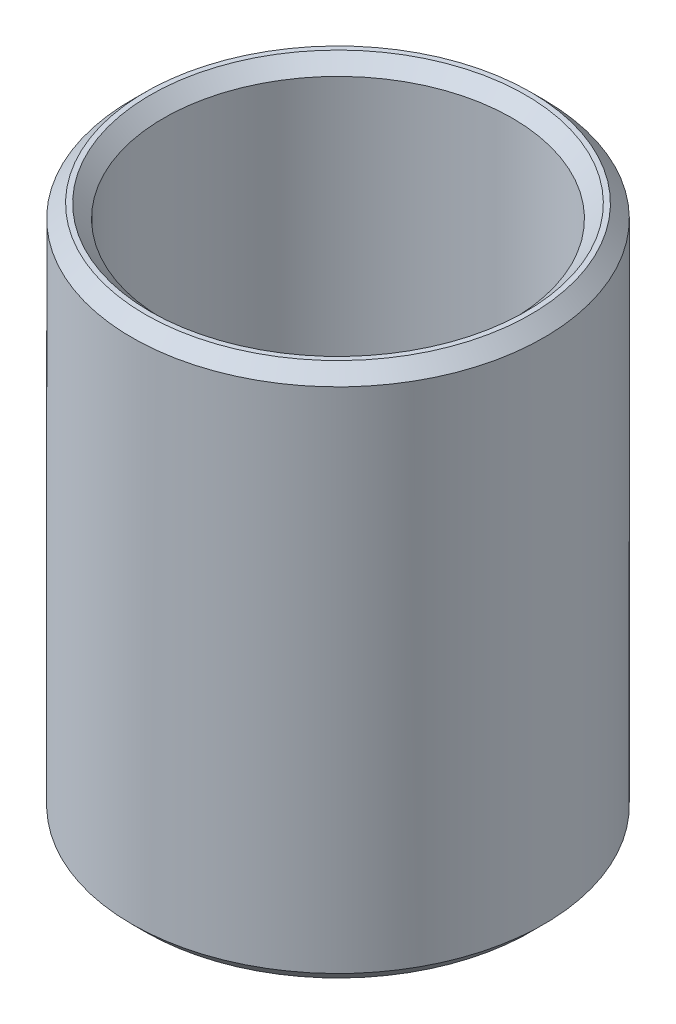
from build123d import *

# Parameters (mm, degrees)
SKETCH1_R           = 60
BOSS_EXTRUDE1_DEPTH = 155.73988297
SKETCH2_R           = 50.764711416
CUT_EXTRUDE1_DEPTH  = 178.355324553
CHAMFER1_SIZE       = 3.887636681


with BuildPart() as part:
    # Sketch1 → Boss-Extrude1 (new body)
    with BuildSketch(Plane(origin=(0, 0, 0), x_dir=(1, 0, 0), z_dir=(0, 1, 0))):
        Circle(SKETCH1_R)
    extrude(amount=BOSS_EXTRUDE1_DEPTH)

    # Sketch2 → Cut-Extrude1 (cut, through all)
    with BuildSketch(Plane(origin=(0, 0, 0), x_dir=(1, 0, 0), z_dir=(0, 1, 0))):
        Circle(SKETCH2_R)
    extrude(amount=CUT_EXTRUDE1_DEPTH, mode=Mode.SUBTRACT)

    # Chamfer1
    chamfer1_edges = [part.edges().sort_by_distance(p)[0] for p in [
        (-50.764711416, 155.73988297, 0),
        (-50.764711416, 0, 0),
        (-60, 0, 0),
        (-60, 155.73988297, 0),
    ]]
    chamfer(chamfer1_edges, length=CHAMFER1_SIZE)


solid = part.part
